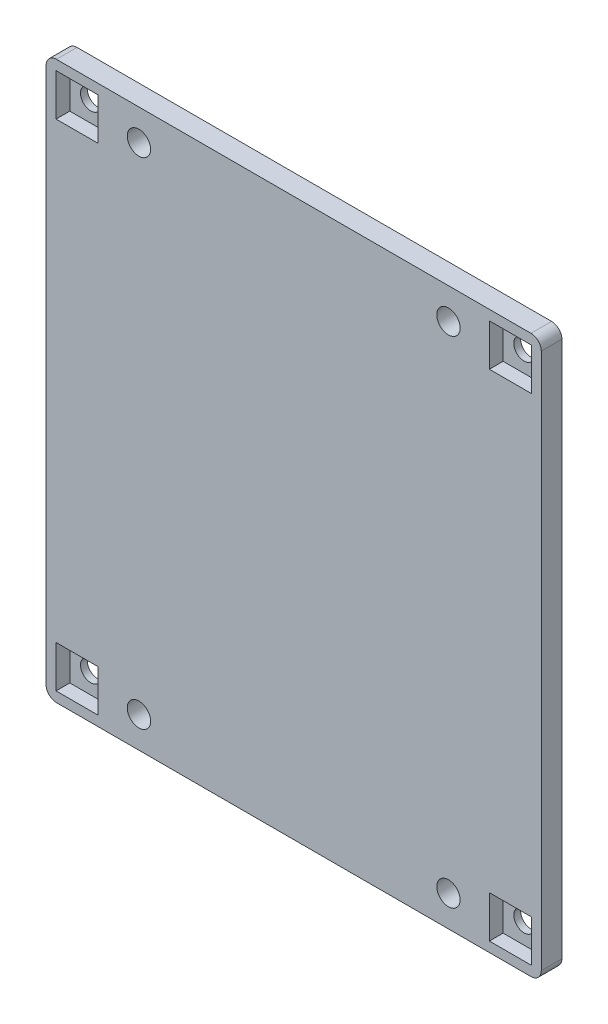
from build123d import *

# Parameters (mm, degrees)
MODEL_R                 = 1.5
MODEL_R_2               = 1.7
SALIENTE_EXTRUIR1_DEPTH = 3
CROQUIS2_W              = 6.1
CROQUIS2_H              = 6.1
CORTAR_EXTRUIR1_DEPTH   = 2


with BuildPart() as part:
    # Model → Saliente-Extruir1 (new body)
    with BuildSketch(Plane.XY):
        with BuildLine():
            Line((6.187693969, 221.409928006), (6.187693969, 299.414537864))
            ThreePointArc((6.187693969, 299.414537864), (6.627033797, 300.475198036), (7.687693969, 300.914537864))
            Line((7.687693969, 300.914537864), (76.690098203, 300.914537864))
            ThreePointArc((76.690098203, 300.914537864), (77.750758375, 300.475198036), (78.190098203, 299.414537864))
            Line((78.190098203, 299.414537864), (78.190098203, 221.409928006))
            ThreePointArc((78.190098203, 221.409928006), (77.750758375, 220.349267835), (76.690098203, 219.909928006))
            Line((76.690098203, 219.909928006), (7.687693969, 219.909928006))
            ThreePointArc((7.687693969, 219.909928006), (6.627033797, 220.349267835), (6.187693969, 221.409928006))
        make_face()
        with Locations((73.690098203, 224.409593504)):
            Circle(MODEL_R, mode=Mode.SUBTRACT)
        with Locations((10.687359467, 296.414537864)):
            Circle(MODEL_R, mode=Mode.SUBTRACT)
        with Locations((10.687359467, 224.409593504)):
            Circle(MODEL_R, mode=Mode.SUBTRACT)
        with Locations((73.690098203, 296.414537864)):
            Circle(MODEL_R, mode=Mode.SUBTRACT)
        with Locations((19.687024964, 296.414537864)):
            Circle(MODEL_R_2, mode=Mode.SUBTRACT)
        with Locations((64.690432705, 296.414537864)):
            Circle(MODEL_R_2, mode=Mode.SUBTRACT)
        with Locations((19.687024964, 224.409593504)):
            Circle(MODEL_R_2, mode=Mode.SUBTRACT)
        with Locations((64.690432705, 224.409593504)):
            Circle(MODEL_R_2, mode=Mode.SUBTRACT)
    extrude(amount=SALIENTE_EXTRUIR1_DEPTH)

    # Croquis2 → Cortar-Extruir1 (cut)
    with BuildSketch(Plane.XY.offset(3)):
        with Locations((10.687359467, 296.414537864)):
            Rectangle(CROQUIS2_W, CROQUIS2_H)
        with Locations((73.690098203, 296.414537864)):
            Rectangle(CROQUIS2_W, CROQUIS2_H)
        with Locations((73.690098203, 224.409593504)):
            Rectangle(CROQUIS2_W, CROQUIS2_H)
        with Locations((10.687359467, 224.409593504)):
            Rectangle(CROQUIS2_W, CROQUIS2_H)
    extrude(amount=-CORTAR_EXTRUIR1_DEPTH, mode=Mode.SUBTRACT)


solid = part.part
